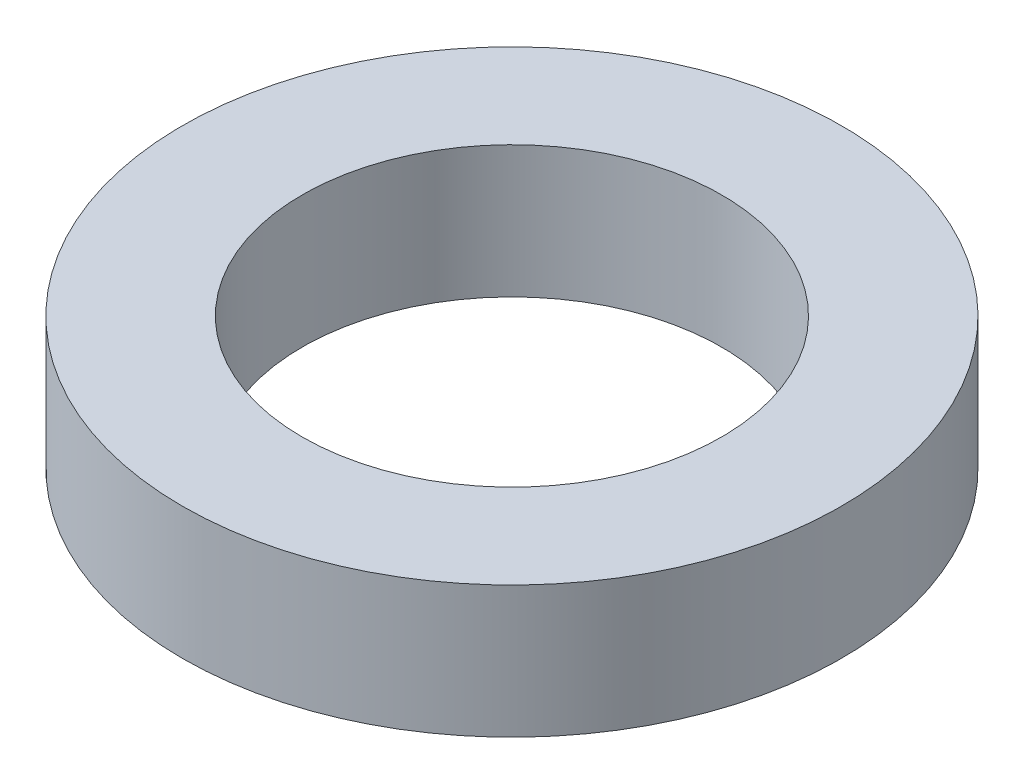
from build123d import *

# Parameters (mm, degrees)
SKETCH1_R           = 55
BOSS_EXTRUDE1_DEPTH = 22
SKETCH2_R           = 35
CUT_EXTRUDE1_DEPTH  = 81.833161512


with BuildPart() as part:
    # Sketch1 → Boss-Extrude1 (new body)
    with BuildSketch(Plane(origin=(0, 0, 0), x_dir=(1, 0, 0), z_dir=(0, 1, 0))):
        Circle(SKETCH1_R)
    extrude(amount=BOSS_EXTRUDE1_DEPTH)

    # Sketch2 → Cut-Extrude1 (cut, through all)
    with BuildSketch(Plane(origin=(0, 0, 0), x_dir=(1, 0, 0), z_dir=(0, 1, 0))):
        Circle(SKETCH2_R)
    extrude(amount=CUT_EXTRUDE1_DEPTH, mode=Mode.SUBTRACT)


solid = part.part
